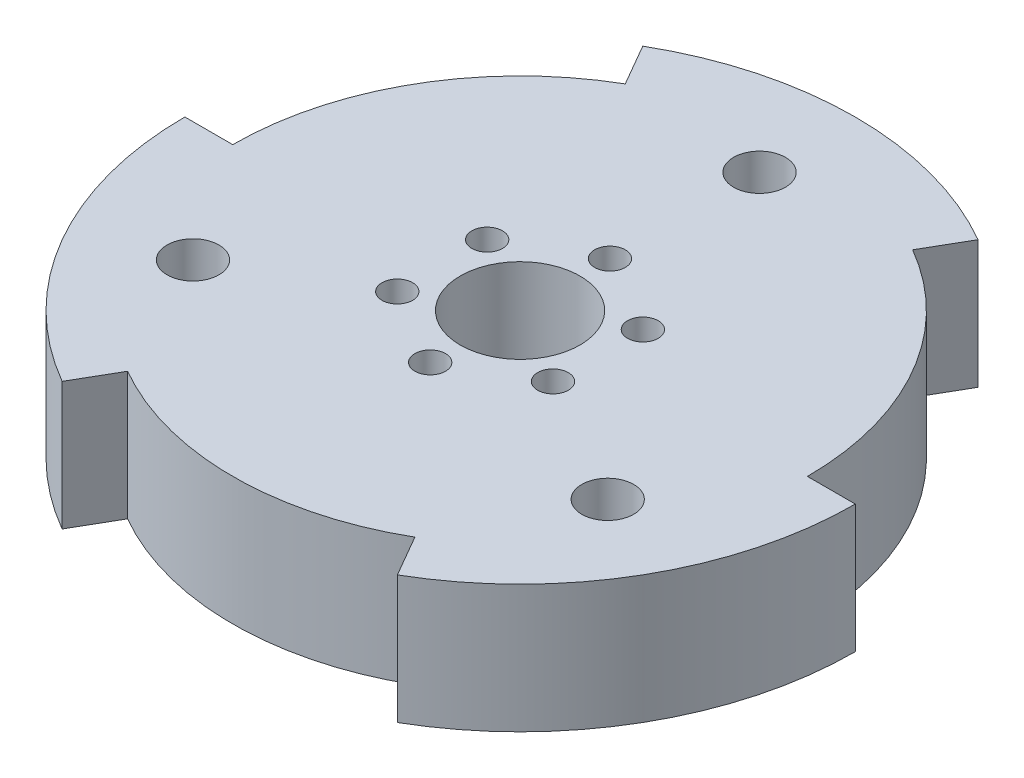
from build123d import *

# Parameters (mm, degrees)
SKETCH1_R               = 2.707265749
SKETCH1_R_2             = 6.25
BOSS_EXTRUDE1_DEPTH     = 13.35
CUT_EXTRUDE1_DEPTH      = 52.266192564
CUT_EXTRUDE1_DEPTH_BACK = 52.266192564
SKETCH6_R               = 1.6


with BuildPart() as part:
    # Sketch1 → Boss-Extrude1 (new body)
    with BuildSketch(Plane(origin=(0, 0, 0), x_dir=(1, 0, 0), z_dir=(0, 1, 0))):
        with BuildLine():
            ThreePointArc((30, 0), (25.980762114, 15), (15, 25.980762114))
            Line((15, 25.980762114), (17.5, 30.310889132))
            ThreePointArc((17.5, 30.310889132), (0, 35), (-17.5, 30.310889132))
            Line((-17.5, 30.310889132), (-15, 25.980762114))
            ThreePointArc((-15, 25.980762114), (-25.980762114, 15), (-30, 0))
            Line((-30, 0), (-35, 0))
            ThreePointArc((-35, 0), (-30.310889132, -17.5), (-17.5, -30.310889132))
            Line((-17.5, -30.310889132), (-15, -25.980762114))
            ThreePointArc((-15, -25.980762114), (0, -30), (15, -25.980762114))
            Line((15, -25.980762114), (17.5, -30.310889132))
            ThreePointArc((17.5, -30.310889132), (30.310889132, -17.5), (35, 0))
            Line((35, 0), (30, 0))
        make_face()
        with Locations((-21.650635095, -12.5)):
            Circle(SKETCH1_R, mode=Mode.SUBTRACT)
        with Locations((21.650635095, -12.5)):
            Circle(SKETCH1_R, mode=Mode.SUBTRACT)
        Circle(SKETCH1_R_2, mode=Mode.SUBTRACT)
        with Locations((0, 25)):
            Circle(SKETCH1_R, mode=Mode.SUBTRACT)
    extrude(amount=BOSS_EXTRUDE1_DEPTH)

    # Sketch6 → Cut-Extrude1 (cut, two sides: drawn at the far end of the back side and taken through both)
    with BuildSketch(Plane(origin=(0, 13.35, 0), x_dir=(1, 0, 0), z_dir=(0, 1, 0)).offset(-CUT_EXTRUDE1_DEPTH_BACK)):
        with Locations((0, -9.385)):
            Circle(SKETCH6_R)
        with Locations((-8.127648415, -4.6925)):
            Circle(SKETCH6_R)
        with Locations((-8.127648415, 4.6925)):
            Circle(SKETCH6_R)
        with Locations((0, 9.385)):
            Circle(SKETCH6_R)
        with Locations((8.127648415, 4.6925)):
            Circle(SKETCH6_R)
        with Locations((8.127648415, -4.6925)):
            Circle(SKETCH6_R)
    extrude(amount=CUT_EXTRUDE1_DEPTH + CUT_EXTRUDE1_DEPTH_BACK, mode=Mode.SUBTRACT)


solid = part.part
